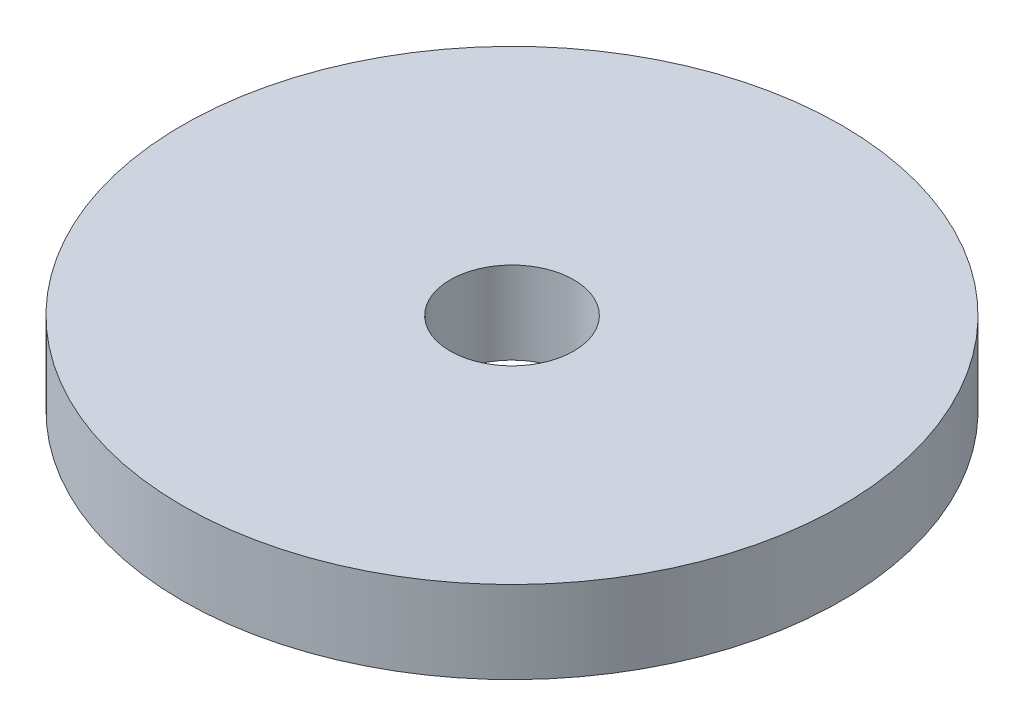
from build123d import *

# Parameters (mm, degrees)
SKETCH1_R           = 50.8
SKETCH1_R_2         = 9.525
BOSS_EXTRUDE1_DEPTH = 12.7


with BuildPart() as part:
    # Sketch1 → Boss-Extrude1 (new body)
    with BuildSketch(Plane(origin=(0, 0, 0), x_dir=(1, 0, 0), z_dir=(0, 1, 0))):
        Circle(SKETCH1_R)
        Circle(SKETCH1_R_2, mode=Mode.SUBTRACT)
    extrude(amount=BOSS_EXTRUDE1_DEPTH)


solid = part.part
